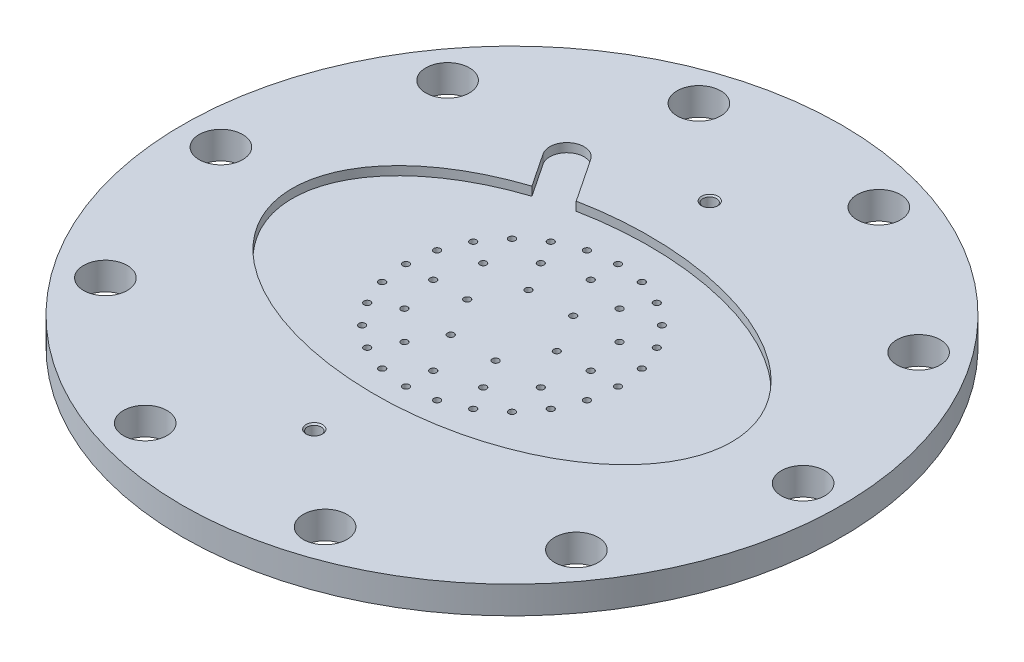
from build123d import *

# Parameters (mm, degrees)
F_3_8_CLEARANCE_HOLE1_D                = 10.0838
CIRPATTERN1_COUNT                      = 10
SKETCH5_RX                             = 50.8
SKETCH5_RY                             = 31.75
CUT_EXTRUDE1_DEPTH                     = 2.032
F_1_8_0_125_DIAMETER_HOLE1_D           = 3.175
F_1_8_0_125_DIAMETER_HOLE1_DEPTH       = 2.856133767
F_1_8_0_125_DIAMETER_HOLE1_CSINK_D     = 3.81
F_1_8_0_125_DIAMETER_HOLE1_CSINK_ANGLE = 90
F_1_8_0_125_DIAMETER_HOLE1_TIP         = 0.953866233
CUT_EXTRUDE2_DEPTH                     = 108.849548557
CUT_EXTRUDE2_DEPTH_BACK                = 108.849548557
SKETCH8_R                              = 0.75565


with BuildPart() as part:
    # Sketch1 → Revolve1 (revolve)
    with BuildSketch(Plane.XY):
        Polygon((0, -6.35), (54.8259, -6.35), (54.8259, -3.6576), (58.8899, -3.6576), (58.8899, -6.35), (76.2, -6.35), (76.2, 0), (0, 0), align=None)
    revolve(axis=Axis((0, 0, 0), (0, -1, 0)))

    # 3/8 Clearance Hole1 (through all)
    with Locations(Plane(origin=(67.31, 0, 0), x_dir=(0, 0, 1), z_dir=(0, 1, 0))):
        with Locations((0, 0)):
            f_3_8_clearance_hole1 = Hole(F_3_8_CLEARANCE_HOLE1_D / 2)

    # CirPattern1: 3/8 Clearance Hole1 ×10 about axis
    cirpattern1_axis = Axis((0, 0.3175, 0), (0, -1, 0))
    for i in range(1, CIRPATTERN1_COUNT):
        add(f_3_8_clearance_hole1.rotate(cirpattern1_axis, i * 360 / CIRPATTERN1_COUNT), mode=Mode.SUBTRACT)

    # Sketch5 → Cut-Extrude1 (cut)
    with BuildSketch(Plane(origin=(0, 0, 0), x_dir=(1, 0, 0), z_dir=(0, 1, 0))):
        with Locations((0, 0)):
            Ellipse(SKETCH5_RX, SKETCH5_RY)
        with BuildLine():
            Line((-3.302199606, -2.201466404), (-28.702199606, 35.898533596))
            ThreePointArc((-28.702199606, 35.898533596), (-27.601466404, 41.402199606), (-22.097800394, 40.301466404))
            Line((-22.097800394, 40.301466404), (3.302199606, 2.201466404))
            ThreePointArc((3.302199606, 2.201466404), (2.201466404, -3.302199606), (-3.302199606, -2.201466404))
        make_face()
    extrude(amount=-CUT_EXTRUDE1_DEPTH, mode=Mode.SUBTRACT)

    # 1/8 (0.125) Diameter Hole1
    with Locations(Plane(origin=(0, 0, -45.72), x_dir=(0, 0, 1), z_dir=(0, 1, 0))):
        with Locations((0, 0), (91.44, 0)):
            CounterSinkHole(F_1_8_0_125_DIAMETER_HOLE1_D / 2, F_1_8_0_125_DIAMETER_HOLE1_CSINK_D / 2, depth=F_1_8_0_125_DIAMETER_HOLE1_DEPTH, counter_sink_angle=F_1_8_0_125_DIAMETER_HOLE1_CSINK_ANGLE)
            with Locations((0, 0, -(F_1_8_0_125_DIAMETER_HOLE1_DEPTH + F_1_8_0_125_DIAMETER_HOLE1_TIP / 2))):  # 118° drill point
                Cone(0, F_1_8_0_125_DIAMETER_HOLE1_D / 2, F_1_8_0_125_DIAMETER_HOLE1_TIP, mode=Mode.SUBTRACT)

    # Sketch8 → Cut-Extrude2 (cut, two sides: drawn at the far end of the back side and taken through both)
    with BuildSketch(Plane(origin=(0, -2.032, 0), x_dir=(1, 0, 0), z_dir=(0, 1, 0)).offset(-CUT_EXTRUDE2_DEPTH_BACK)):
        with Locations((-10.3632, 0)):
            Circle(SKETCH8_R)
        with Locations((-18.2118, 0)):
            Circle(SKETCH8_R)
        with Locations((-24.511, 0)):
            Circle(SKETCH8_R)
        with Locations((-5.1816, 8.974794464)):
            Circle(SKETCH8_R)
        with Locations((5.1816, 8.974794464)):
            Circle(SKETCH8_R)
        with Locations((10.3632, 0)):
            Circle(SKETCH8_R)
        with Locations((5.1816, -8.974794464)):
            Circle(SKETCH8_R)
        with Locations((-5.1816, -8.974794464)):
            Circle(SKETCH8_R)
        with Locations((-15.771881449, 9.1059)):
            Circle(SKETCH8_R)
        with Locations((-9.1059, 15.771881449)):
            Circle(SKETCH8_R)
        with Locations((0, 18.2118)):
            Circle(SKETCH8_R)
        with Locations((9.1059, 15.771881449)):
            Circle(SKETCH8_R)
        with Locations((15.771881449, 9.1059)):
            Circle(SKETCH8_R)
        with Locations((18.2118, 0)):
            Circle(SKETCH8_R)
        with Locations((15.771881449, -9.1059)):
            Circle(SKETCH8_R)
        with Locations((9.1059, -15.771881449)):
            Circle(SKETCH8_R)
        with Locations((0, -18.2118)):
            Circle(SKETCH8_R)
        with Locations((-9.1059, -15.771881449)):
            Circle(SKETCH8_R)
        with Locations((-15.771881449, -9.1059)):
            Circle(SKETCH8_R)
        with Locations((-23.675807928, 6.343913615)):
            Circle(SKETCH8_R)
        with Locations((-21.227148672, 12.2555)):
            Circle(SKETCH8_R)
        with Locations((-17.331894314, 17.331894314)):
            Circle(SKETCH8_R)
        with Locations((-12.2555, 21.227148672)):
            Circle(SKETCH8_R)
        with Locations((-6.343913615, 23.675807928)):
            Circle(SKETCH8_R)
        with Locations((0, 24.511)):
            Circle(SKETCH8_R)
        with Locations((6.343913615, 23.675807928)):
            Circle(SKETCH8_R)
        with Locations((12.2555, 21.227148672)):
            Circle(SKETCH8_R)
        with Locations((17.331894314, 17.331894314)):
            Circle(SKETCH8_R)
        with Locations((21.227148672, 12.2555)):
            Circle(SKETCH8_R)
        with Locations((23.675807928, 6.343913615)):
            Circle(SKETCH8_R)
        with Locations((24.511, 0)):
            Circle(SKETCH8_R)
        with Locations((23.675807928, -6.343913615)):
            Circle(SKETCH8_R)
        with Locations((21.227148672, -12.2555)):
            Circle(SKETCH8_R)
        with Locations((17.331894314, -17.331894314)):
            Circle(SKETCH8_R)
        with Locations((12.2555, -21.227148672)):
            Circle(SKETCH8_R)
        with Locations((6.343913615, -23.675807928)):
            Circle(SKETCH8_R)
        with Locations((0, -24.511)):
            Circle(SKETCH8_R)
        with Locations((-6.343913615, -23.675807928)):
            Circle(SKETCH8_R)
        with Locations((-12.2555, -21.227148672)):
            Circle(SKETCH8_R)
        with Locations((-17.331894314, -17.331894314)):
            Circle(SKETCH8_R)
        with Locations((-21.227148672, -12.2555)):
            Circle(SKETCH8_R)
        with Locations((-23.675807928, -6.343913615)):
            Circle(SKETCH8_R)
    extrude(amount=CUT_EXTRUDE2_DEPTH + CUT_EXTRUDE2_DEPTH_BACK, mode=Mode.SUBTRACT)


solid = part.part
